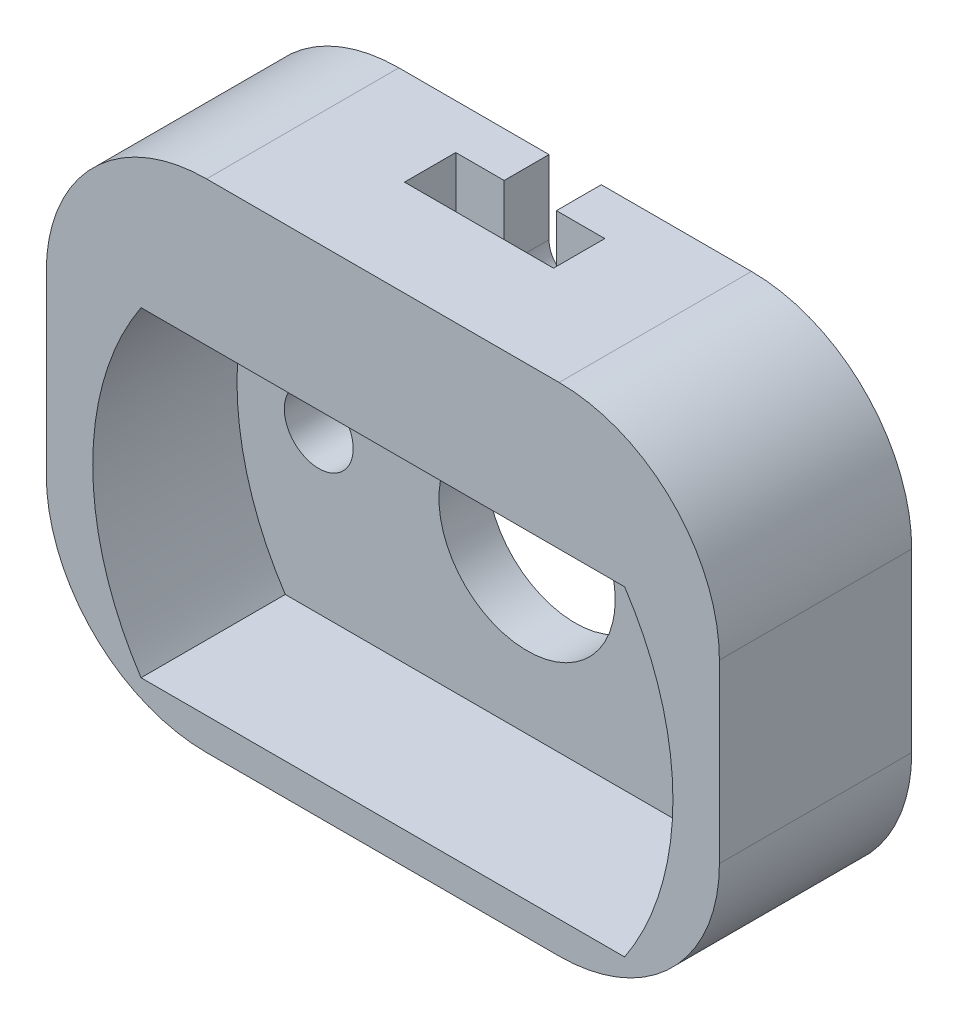
from build123d import *

# Parameters (mm, degrees)
SKETCH1_W               = 42
SKETCH1_H               = 31
BOSS_EXTRUDE1_DEPTH     = 12
CUT_EXTRUDE1_DEPTH      = 9
SKETCH4_R               = 2.15
CUT_EXTRUDE3_DEPTH      = 10
BOSS_EXTRUDE2_START     = -8.28
BOSS_EXTRUDE2_OUTLINE_W = 9.3
BOSS_EXTRUDE2_OUTLINE_H = 3.2
BOSS_EXTRUDE2_DEPTH     = 8.28
SKETCH6_R               = 1.63
CUT_EXTRUDE4_DEPTH      = 2.8
SKETCH7_W               = 3.26
SKETCH7_H               = 4.6
CUT_EXTRUDE5_DEPTH      = 2.8
FILLET1_R               = 10
SKETCH14_R              = 5.5
CUT_EXTRUDE7_DEPTH      = 53.971690553


# Read off the part's stored shape, not the designer's step: Boss-Extrude2
with BuildPart() as part:
    # Sketch1 → Boss-Extrude1 (new body)
    with BuildSketch(Plane.XY):
        with Locations((21, 15.5)):
            Rectangle(SKETCH1_W, SKETCH1_H)
    extrude(amount=BOSS_EXTRUDE1_DEPTH)

    # Sketch2 → Cut-Extrude1 (cut)
    with BuildSketch(Plane.XY.offset(12)):
        with BuildLine():
            Line((36.086749153, 22), (5.913250847, 22))
            ThreePointArc((5.913250847, 22), (2.9, 12), (5.913250847, 2))
            Line((5.913250847, 2), (36.086749153, 2))
            ThreePointArc((36.086749153, 2), (39.1, 12), (36.086749153, 22))
        make_face()
    extrude(amount=-CUT_EXTRUDE1_DEPTH, mode=Mode.SUBTRACT)

    # Sketch4 → Cut-Extrude3 (cut)
    with BuildSketch(Plane.XY.offset(3)):
        with Locations((8, 12)):
            Circle(SKETCH4_R)
        with Locations((34, 12)):
            Circle(SKETCH4_R)
    extrude(amount=-CUT_EXTRUDE3_DEPTH, mode=Mode.SUBTRACT)

    # Boss-Extrude2 outline → Boss-Extrude2 (cut)
    with BuildSketch(Plane(origin=(0, 31, 0), x_dir=(1, 0, 0), z_dir=(0, 1, 0)).offset(BOSS_EXTRUDE2_START)):
        with Locations((21, -4.4)):
            Rectangle(BOSS_EXTRUDE2_OUTLINE_W, BOSS_EXTRUDE2_OUTLINE_H)
    extrude(amount=BOSS_EXTRUDE2_DEPTH, mode=Mode.SUBTRACT)

    # Sketch6 → Cut-Extrude4 (cut)
    with BuildSketch(Plane(origin=(0, 0, 0), x_dir=(-1, 0, 0), z_dir=(0, 0, -1))):
        with Locations((-21, 26.4)):
            Circle(SKETCH6_R)
    extrude(amount=-CUT_EXTRUDE4_DEPTH, mode=Mode.SUBTRACT)

    # Sketch7 → Cut-Extrude5 (cut)
    with BuildSketch(Plane(origin=(0, 0, 0), x_dir=(-1, 0, 0), z_dir=(0, 0, -1))):
        with Locations((-21, 28.7)):
            Rectangle(SKETCH7_W, SKETCH7_H)
    extrude(amount=-CUT_EXTRUDE5_DEPTH, mode=Mode.SUBTRACT)

    # Fillet1
    fillet1_edges = [part.edges().sort_by_distance(p)[0] for p in [
        (0, 0, 6),
        (0, 31, 6),
        (42, 31, 6),
        (42, 0, 6),
    ]]
    fillet(fillet1_edges, radius=FILLET1_R)

    # Sketch14 → Cut-Extrude7 (cut, through all)
    with BuildSketch(Plane.XY.offset(3)):
        with Locations((21, 12)):
            Circle(SKETCH14_R)
    extrude(amount=-CUT_EXTRUDE7_DEPTH, mode=Mode.SUBTRACT)


solid = part.part
